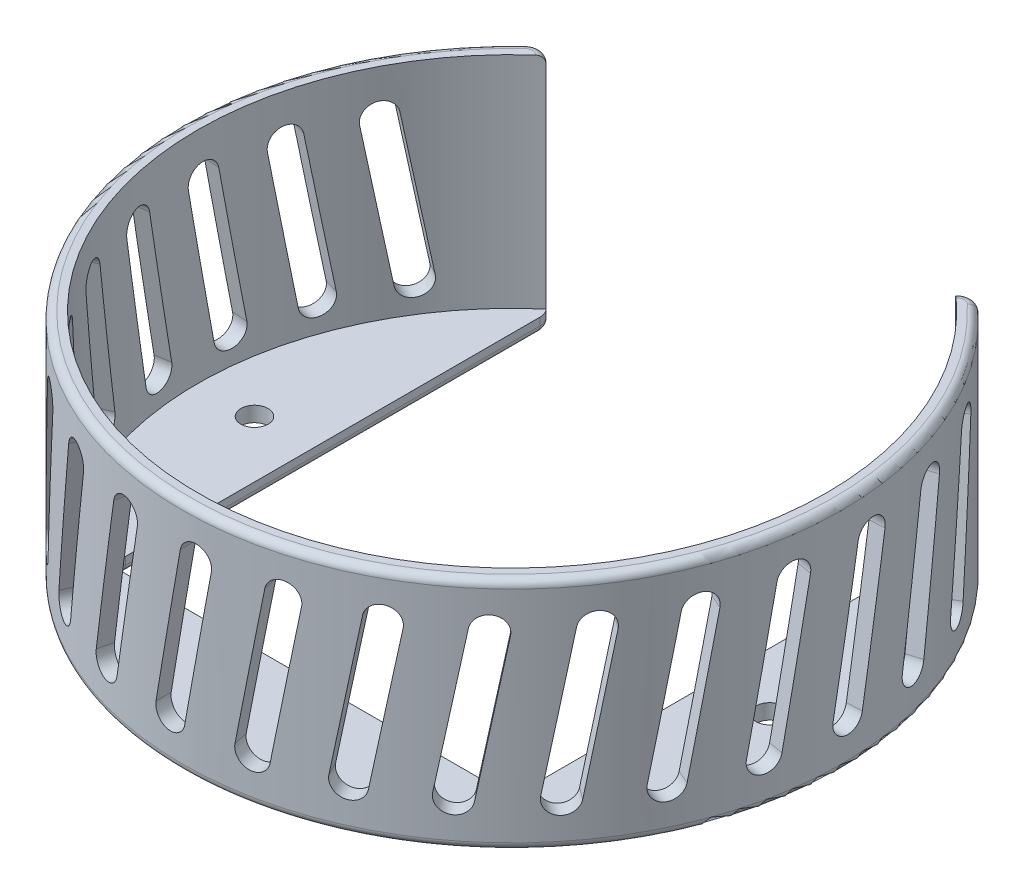
from build123d import *

# Parameters (mm, degrees)
SKETCH1_R                       = 43.5
BOSS_EXTRUDE1_DEPTH             = 2
SKETCH2_R                       = 43.5
SKETCH2_R_2                     = 41.5
BOSS_EXTRUDE2_DEPTH             = 29
SKETCH4_R                       = 1.8
CUT_EXTRUDE2_DEPTH              = 69.887589593
CUT_EXTRUDE3_DEPTH              = 69.887589593
CUT_EXTRUDE4_DEPTH              = 10
CIRPATTERN1_COUNT               = 10
CIRPATTERN1_ANGLE               = 120
CIRPATTERN1_THE_OTHER_WAY_COUNT = 10
CIRPATTERN1_THE_OTHER_WAY_ANGLE = 120
FILLET1_R                       = 2
FILLET2_R                       = 1


with BuildPart() as part:
    # Sketch1 → Boss-Extrude1 (new body)
    with BuildSketch(Plane(origin=(0, 0, 0), x_dir=(1, 0, 0), z_dir=(0, 1, 0))):
        with Locations(Location((0, 0, 0), (0, 0, 270))):
            Circle(SKETCH1_R)
    extrude(amount=BOSS_EXTRUDE1_DEPTH)

    # Sketch2 → Boss-Extrude2 (add)
    with BuildSketch(Plane(origin=(0, 2, 0), x_dir=(1, 0, 0), z_dir=(0, 1, 0))):
        with Locations(Location((0, 0, 0), (0, 0, 270))):
            Circle(SKETCH2_R)
        with Locations(Location((0, 0, 0), (0, 0, 90))):
            Circle(SKETCH2_R_2, mode=Mode.SUBTRACT)
    extrude(amount=BOSS_EXTRUDE2_DEPTH)

    # Sketch4 → Cut-Extrude2 (cut, through all)
    with BuildSketch(Plane.XZ):
        with Locations(Location((34, 0, 0), (0, 0, 270))):
            Circle(SKETCH4_R)
        with Locations(Location((17, -29.444863729, 0), (0, 0, 270))):
            Circle(SKETCH4_R)
        with Locations(Location((-17, -29.444863729, 0), (0, 0, 270))):
            Circle(SKETCH4_R)
        with Locations(Location((-34, 0, 0), (0, 0, 270))):
            Circle(SKETCH4_R)
        with Locations(Location((-17, 29.444863729, 0), (0, 0, 270))):
            Circle(SKETCH4_R)
        with Locations(Location((17, 29.444863729, 0), (0, 0, 270))):
            Circle(SKETCH4_R)
    extrude(amount=-CUT_EXTRUDE2_DEPTH, mode=Mode.SUBTRACT)

    # Sketch5 → Cut-Extrude3 (cut, through all)
    with BuildSketch(Plane.XZ):
        with BuildLine():
            Line((-26.5, 26.503623379), (26.5, 26.503623379))
            Line((26.5, 26.503623379), (26.5, -34.496376621))
            ThreePointArc((26.5, -34.496376621), (0, -43.5), (-26.5, -34.496376621))
            Line((-26.5, -34.496376621), (-26.5, 26.503623379))
        make_face()
    extrude(amount=-CUT_EXTRUDE3_DEPTH, mode=Mode.SUBTRACT)

    # Sketch6 → Cut-Extrude4 (cut)
    with BuildSketch(Plane.XY.offset(43.5)):
        with BuildLine():
            Line((-3.650079429, 6.316911861), (-0.289151583, 25.377680849))
            ThreePointArc((-0.289151583, 25.377680849), (2.027760278, 27), (3.650079429, 24.683088139))
            Line((3.650079429, 24.683088139), (0.289151583, 5.622319151))
            ThreePointArc((0.289151583, 5.622319151), (-2.027760278, 4), (-3.650079429, 6.316911861))
        make_face()
    cut_extrude4 = extrude(amount=-CUT_EXTRUDE4_DEPTH, mode=Mode.SUBTRACT)

    # CirPattern1: Cut-Extrude4 ×10 about axis
    cirpattern1_axis = Axis((0, 0, 0), (0, 1, 0))
    for i in range(1, CIRPATTERN1_COUNT):
        add(cut_extrude4.rotate(cirpattern1_axis, i * CIRPATTERN1_ANGLE / (CIRPATTERN1_COUNT - 1)), mode=Mode.SUBTRACT)

    # CirPattern1 the other way: Cut-Extrude4 ×10 about axis
    cirpattern1_the_other_way_axis = Axis((0, 0, 0), (0, -1, 0))
    for i in range(1, CIRPATTERN1_THE_OTHER_WAY_COUNT):
        add(cut_extrude4.rotate(cirpattern1_the_other_way_axis, i * CIRPATTERN1_THE_OTHER_WAY_ANGLE / (CIRPATTERN1_THE_OTHER_WAY_COUNT - 1)), mode=Mode.SUBTRACT)

    # Fillet1
    fillet1_edges = [part.edges().sort_by_distance(p)[0] for p in [
        (-26.5, 15.5, -34.496376621),
        (26.5, 15.5, -34.496376621),
        (26.5, 1, 26.503623379),
        (-26.5, 1, 26.503623379),
    ]]
    fillet(fillet1_edges, radius=FILLET1_R)

    # Fillet2
    # the kernel refuses this fillet: 1 mm, written as the material it takes off along each edge
    with BuildSketch(Plane(origin=(0, 31, 0), x_dir=(0.6867469879518066, 0, -0.7268965363372709), z_dir=(-0.7268965363372709, 0, -0.6867469879518066))) as fillet2_piece_1:
        with BuildLine():
            CenterArc((43.5 - FILLET2_R, FILLET2_R), FILLET2_R, 270, 90)
            Line((43.5 - FILLET2_R, 0), (43.5, 0))
            Line((43.5, 0), (43.5, FILLET2_R))
        make_face()
    revolve(axis=Axis((0, 31, 0), (0, -1, 0)), revolution_arc=273.25369359, mode=Mode.SUBTRACT)
    with BuildSketch(Plane(origin=(0, 0, 0), x_dir=(-0.6867469879518071, 0, -0.7268965363372702), z_dir=(0.7268965363372702, 0, -0.6867469879518071))) as fillet2_piece_2:
        with BuildLine():
            CenterArc((43.5 - FILLET2_R, FILLET2_R), FILLET2_R, 270, 90)
            Line((43.5 - FILLET2_R, 0), (43.5, 0))
            Line((43.5, 0), (43.5, FILLET2_R))
        make_face()
    revolve(axis=Axis((0, 0, 0), (0, 1, 0)), revolution_arc=273.25369359, mode=Mode.SUBTRACT)
    with BuildSketch(Plane(origin=(-26.5, 0, -30.166206258), x_dir=(-1, 0, 0), z_dir=(0, 0, 1)), Plane(origin=(26.5, 0, 24.503623379), x_dir=(1, 0, 0), z_dir=(0, 0, -1))) as fillet2_piece_3:
        with BuildLine():
            CenterArc((FILLET2_R, -FILLET2_R), FILLET2_R, 90, 90)
            Line((0, -FILLET2_R), (0, 0))
            Line((0, 0), (FILLET2_R, 0))
        make_face()
    extrude(amount=54.669829637, mode=Mode.SUBTRACT)
    with BuildSketch(Plane(origin=(-24.5, 0, 26.503623379), x_dir=(0, 0, 1), z_dir=(1, 0, 0))) as fillet2_piece_4:
        with BuildLine():
            CenterArc((FILLET2_R, -FILLET2_R), FILLET2_R, 90, 90)
            Line((0, -FILLET2_R), (0, 0))
            Line((0, 0), (FILLET2_R, 0))
        make_face()
    extrude(amount=49, mode=Mode.SUBTRACT)
    with BuildSketch(Plane(origin=(28.5, 0, -30.166206258), x_dir=(0.6867469879517963, 0, -0.7268965363372805), z_dir=(0.7268965363372805, 0, 0.6867469879517963))) as fillet2_piece_5:
        with BuildLine():
            CenterArc((2 - FILLET2_R, FILLET2_R), FILLET2_R, 270, 90)
            Line((2 - FILLET2_R, 0), (2, 0))
            Line((2, 0), (2, FILLET2_R))
        make_face()
    revolve(axis=Axis((28.5, 0, -30.166206258), (0, 1, 0)), revolution_arc=133.373153205, mode=Mode.SUBTRACT)
    with BuildSketch(Plane(origin=(-28.5, 0, -30.166206258), x_dir=(-0.6867469879518, 0, -0.726896536337277), z_dir=(-0.726896536337277, 0, 0.6867469879518))) as fillet2_piece_6:
        with BuildLine():
            CenterArc((2 - FILLET2_R, -FILLET2_R), FILLET2_R, 0, 90)
            Line((2 - FILLET2_R, 0), (2, 0))
            Line((2, 0), (2, -FILLET2_R))
        make_face()
    revolve(axis=Axis((-28.5, 0, -30.166206258), (0, -1, 0)), revolution_arc=133.373153205, mode=Mode.SUBTRACT)
    with BuildSketch(Plane(origin=(28.5, 31, -30.166206258), x_dir=(0.6867469879517927, 0, -0.7268965363372839), z_dir=(0.7268965363372839, 0, 0.6867469879517927))) as fillet2_piece_7:
        with BuildLine():
            CenterArc((2 - FILLET2_R, -FILLET2_R), FILLET2_R, 0, 90)
            Line((2, -FILLET2_R), (2, 0))
            Line((2, 0), (2 - FILLET2_R, 0))
        make_face()
    revolve(axis=Axis((28.5, 31, -30.166206258), (0, 1, 0)), revolution_arc=163.030139252, mode=Mode.SUBTRACT)
    with BuildSketch(Plane(origin=(-28.5, 31, -30.166206258), x_dir=(-0.6867469879518082, 0, -0.7268965363372693), z_dir=(-0.7268965363372693, 0, 0.6867469879518082))) as fillet2_piece_8:
        with BuildLine():
            CenterArc((2 - FILLET2_R, FILLET2_R), FILLET2_R, 270, 90)
            Line((2, FILLET2_R), (2, 0))
            Line((2, 0), (2 - FILLET2_R, 0))
        make_face()
    revolve(axis=Axis((-28.5, 31, -30.166206258), (0, -1, 0)), revolution_arc=163.030139252, mode=Mode.SUBTRACT)
    with BuildSketch(Plane(origin=(24.5, 0, 24.503623379), x_dir=(0, 0, 1), z_dir=(-1, 0, 0))) as fillet2_piece_9:
        with BuildLine():
            CenterArc((2 + FILLET2_R, FILLET2_R), FILLET2_R, 180, 90)
            Line((2, FILLET2_R), (2, 0))
            Line((2, 0), (2 + FILLET2_R, 0))
        make_face()
    revolve(axis=Axis((24.5, 0, 24.503623379), (0, 1, 0)), revolution_arc=90, mode=Mode.SUBTRACT)
    with BuildSketch(Plane(origin=(-24.5, 0, 24.503623379), x_dir=(0, 0, 1), z_dir=(1, 0, 0))) as fillet2_piece_10:
        with BuildLine():
            CenterArc((2 + FILLET2_R, -FILLET2_R), FILLET2_R, 90, 90)
            Line((2, -FILLET2_R), (2, 0))
            Line((2, 0), (2 + FILLET2_R, 0))
        make_face()
    revolve(axis=Axis((-24.5, 0, 24.503623379), (0, -1, 0)), revolution_arc=90, mode=Mode.SUBTRACT)


solid = part.part
